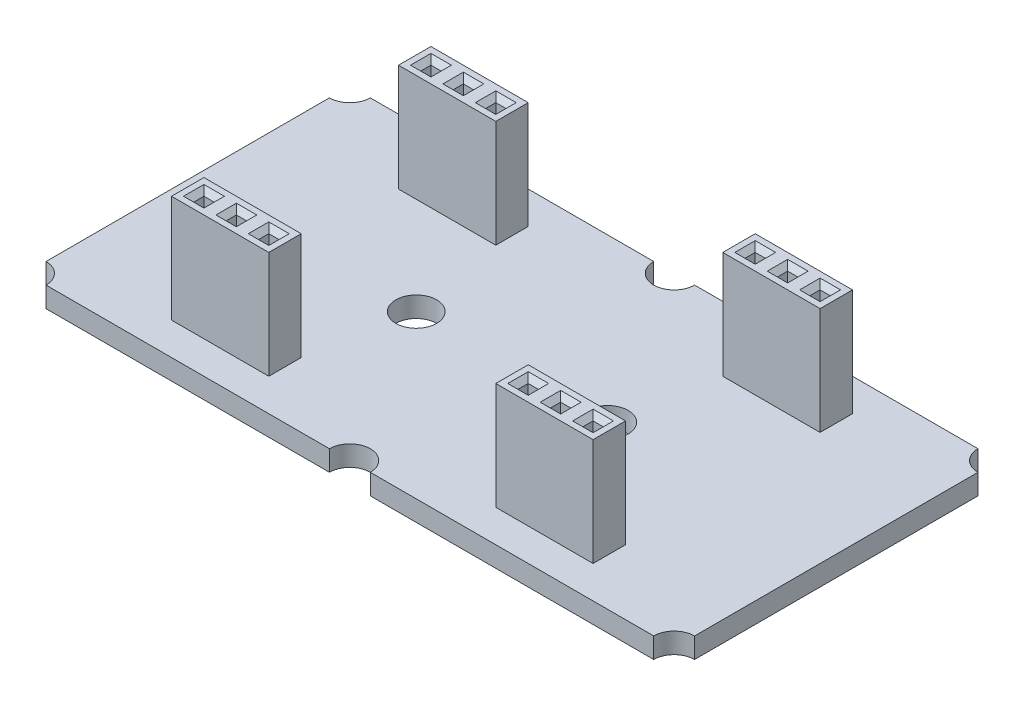
from build123d import *

# Parameters (mm, degrees)
EXTRUDE_1_DEPTH            = 1.6
SKETCH_2_W                 = 7.62
SKETCH_2_H                 = 2.54
SKETCH_2_W_2               = 0.8
SKETCH_2_H_2               = 0.8
EXTRUDE_2_DEPTH            = 8.4
SKETCH_2_2_W               = 0.8
SKETCH_2_2_H               = 0.8
EXTRUDE_3_DEPTH            = 3.2
CHAMFER_1_SIZE             = 0.4
SKETCH_3_R                 = 1.6
CUT_EXTRUDE_1_DEPTH        = 30.614354627
CHAMFER_1_OF_MIRROR_1_SIZE = 0.4


# Read off the part's stored shape, not the designer's step: Зеркальное отражение2
with BuildPart() as part:
    # Эскиз1 → Бобышка-Вытянуть1 (new body)
    with BuildSketch(Plane(origin=(0, 0, 0), x_dir=(1, 0, 0), z_dir=(0, 1, 0))):
        with BuildLine():
            ThreePointArc((23.8, -12.7), (24.26862915, -11.56862915), (25.4, -11.1))
            Line((25.4, -11.1), (25.4, 11.1))
            ThreePointArc((25.4, 11.1), (24.26862915, 11.56862915), (23.8, 12.7))
            Line((23.8, 12.7), (1.6, 12.7))
            ThreePointArc((1.6, 12.7), (0, 11.1), (-1.6, 12.7))
            Line((-1.6, 12.7), (-23.8, 12.7))
            ThreePointArc((-23.8, 12.7), (-24.26862915, 11.56862915), (-25.4, 11.1))
            Line((-25.4, 11.1), (-25.4, -11.1))
            ThreePointArc((-25.4, -11.1), (-24.26862915, -11.56862915), (-23.8, -12.7))
            Line((-23.8, -12.7), (-1.6, -12.7))
            ThreePointArc((-1.6, -12.7), (0, -11.1), (1.6, -12.7))
            Line((1.6, -12.7), (23.8, -12.7))
        make_face()
    extrude(amount=-EXTRUDE_1_DEPTH)

    # Эскиз2 → Бобышка-Вытянуть2 (add)
    with BuildSketch(Plane(origin=(0, 0, 0), x_dir=(1, 0, 0), z_dir=(0, 1, 0))):
        with Locations((-12.7, 8.89)):
            Rectangle(SKETCH_2_W, SKETCH_2_H)
        with Locations((-15.24, 8.89)):
            Rectangle(SKETCH_2_W_2, SKETCH_2_H_2, mode=Mode.SUBTRACT)
        with Locations((-12.7, 8.89)):
            Rectangle(SKETCH_2_W_2, SKETCH_2_H_2, mode=Mode.SUBTRACT)
        with Locations((-10.16, 8.89)):
            Rectangle(SKETCH_2_W_2, SKETCH_2_H_2, mode=Mode.SUBTRACT)
    extrude_2 = extrude(amount=EXTRUDE_2_DEPTH)

    # Эскиз2<2> → Бобышка-Вытянуть3 (add)
    with BuildSketch(Plane(origin=(0, 0, 0), x_dir=(1, 0, 0), z_dir=(0, 1, 0))):
        with Locations((-12.7, 8.89)):
            Rectangle(SKETCH_2_2_W, SKETCH_2_2_H)
        with Locations((-15.24, 8.89)):
            Rectangle(SKETCH_2_2_W, SKETCH_2_2_H)
        with Locations((-10.16, 8.89)):
            Rectangle(SKETCH_2_2_W, SKETCH_2_2_H)
    extrude_3 = extrude(amount=-EXTRUDE_3_DEPTH)

    # Фаска1
    chamfer_1_edges = [part.edges().sort_by_distance(p)[0] for p in [
        (-14.84, 8.4, -8.89),
        (-15.24, 8.4, -9.29),
        (-15.64, 8.4, -8.89),
        (-15.24, 8.4, -8.49),
        (-12.3, 8.4, -8.89),
        (-12.7, 8.4, -9.29),
        (-13.1, 8.4, -8.89),
        (-12.7, 8.4, -8.49),
        (-9.76, 8.4, -8.89),
        (-10.16, 8.4, -9.29),
        (-10.56, 8.4, -8.89),
        (-10.16, 8.4, -8.49),
    ]]
    chamfer(chamfer_1_edges, length=CHAMFER_1_SIZE)

    # Эскиз3 → Вырез-Вытянуть1 (cut, through all)
    with BuildSketch(Plane(origin=(0, 0, 0), x_dir=(1, 0, 0), z_dir=(0, 1, 0))):
        with Locations(Location((-7.5, 0, 0), (0, 0, 270))):
            Circle(SKETCH_3_R)
        with Locations(Location((7.5, 0, 0), (0, 0, 270))):
            Circle(SKETCH_3_R)
    extrude(amount=-CUT_EXTRUDE_1_DEPTH, mode=Mode.SUBTRACT)

    # Зеркальное отражение1: Бобышка-Вытянуть2, Бобышка-Вытянуть3 across plane
    add(extrude_2.mirror(Plane.XY))
    add(extrude_3.mirror(Plane.XY))

    # Фаска1 of Зеркальное отражение1
    chamfer_1_of_mirror_1_edges = [part.edges().sort_by_distance(p)[0] for p in [
        (-14.84, 8.4, 8.89),
        (-15.24, 8.4, 9.29),
        (-15.64, 8.4, 8.89),
        (-15.24, 8.4, 8.49),
        (-12.3, 8.4, 8.89),
        (-12.7, 8.4, 9.29),
        (-13.1, 8.4, 8.89),
        (-12.7, 8.4, 8.49),
        (-9.76, 8.4, 8.89),
        (-10.16, 8.4, 9.29),
        (-10.56, 8.4, 8.89),
        (-10.16, 8.4, 8.49),
    ]]
    chamfer(chamfer_1_of_mirror_1_edges, length=CHAMFER_1_OF_MIRROR_1_SIZE)

    # Зеркальное отражение2: part across plane


with BuildPart() as part_1:
    add(part.part)
    add(part.part.mirror(Plane(origin=(0, 0, 0), x_dir=(0, 0, 1), z_dir=(1, 0, 0))))


solid = part_1.part
